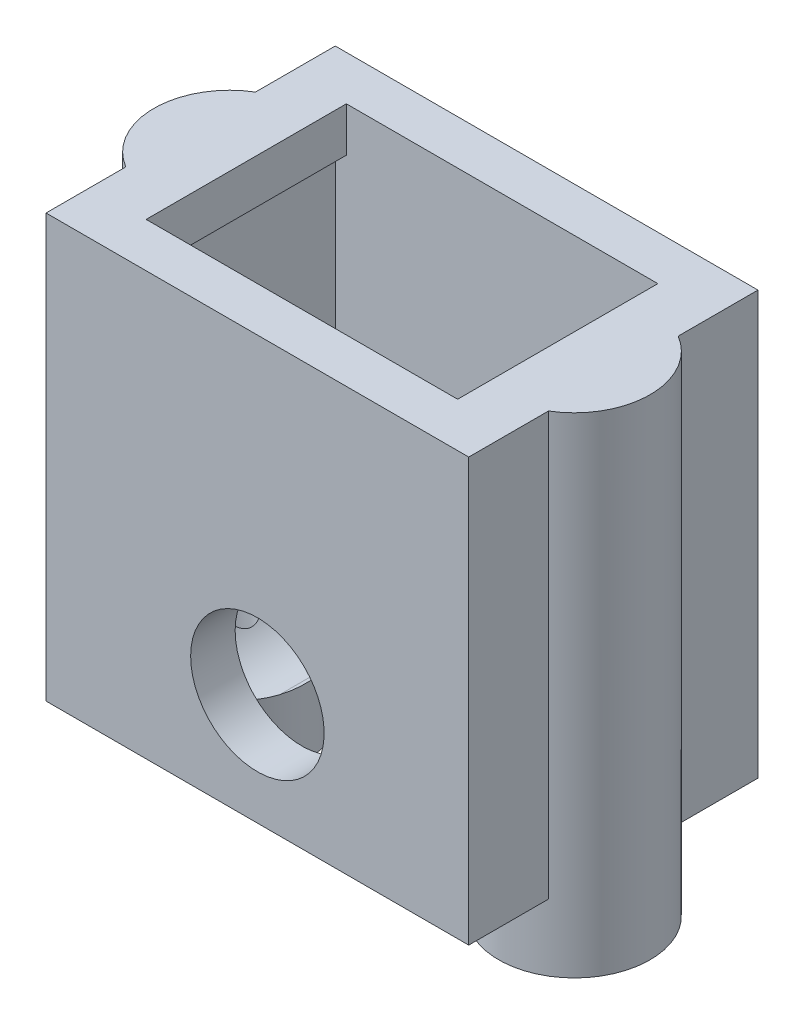
from build123d import *

# Parameters (mm, degrees)
ESBO_O1_W                = 19
ESBO_O1_H                = 13
ESBO_O1_W_2              = 15
ESBO_O1_H_2              = 9
RESSALTO_EXTRUS_O1_DEPTH = 17
ESBO_O2_R                = 3.4
ESBO_O2_R_2              = 1
RESSALTO_EXTRUS_O2_DEPTH = 3
FILETE1_R                = 3
RESSALTO_EXTRUS_O3_START = 19
RESSALTO_EXTRUS_O3_DEPTH = 19
CORTE_EXTRUS_O1_DEPTH    = 26.579728302
ESBO_O5_W                = 0.5
ESBO_O5_H                = 1.584952831
ESBO_O5_W_2              = 2
ESBO_O5_H_2              = 5.830094338
RESSALTO_EXTRUS_O6_DEPTH = 2
CORTE_EXTRUS_O2_START    = -6
ESBO_O7_R                = 1
CORTE_EXTRUS_O2_DEPTH    = 6


with BuildPart() as part:
    # Esboço1 → Ressalto-extrusão1 (new body)
    with BuildSketch(Plane(origin=(0, 0, 0), x_dir=(1, 0, 0), z_dir=(0, 1, 0))):
        Rectangle(ESBO_O1_W, ESBO_O1_H)
        Rectangle(ESBO_O1_W_2, ESBO_O1_H_2, mode=Mode.SUBTRACT)
    extrude(amount=RESSALTO_EXTRUS_O1_DEPTH)

    # Esboço2 → Ressalto-extrusão2 (add)
    # profile 1 of 2: a face of its own
    with BuildSketch(Plane.XZ):
        with Locations(Location((7.75, 0, 0), (0, 0, 94.216730479))):
            Circle(ESBO_O2_R)
        with Locations(Location((7.75, 0, 0), (0, 0, 104.477512186))):
            Circle(ESBO_O2_R_2, mode=Mode.SUBTRACT)
    # profile 2 of 2: a face of its own
    with BuildSketch(Plane.XZ):
        with Locations(Location((-7.75, 0, 0), (0, 0, 85.783269521))):
            Circle(ESBO_O2_R)
        with Locations(Location((-7.75, 0, 0), (0, 0, 75.522487814))):
            Circle(ESBO_O2_R_2, mode=Mode.SUBTRACT)
    extrude(amount=RESSALTO_EXTRUS_O2_DEPTH)

    # Filete1
    # the kernel refuses this fillet: 3 mm, written as the material it adds along each edge
    with BuildSketch(Plane(origin=(-7.5, 0, -6.531754163), x_dir=(0, 1, 0), z_dir=(0, 0, 1))) as filete1_piece_1_section:
        with BuildLine():
            CenterArc((FILETE1_R, -FILETE1_R), FILETE1_R, 90, 90)
            Line((0, -FILETE1_R), (0, 0))
            Line((0, 0), (FILETE1_R, 0))
        make_face()
    filete1_piece_1 = extrude(amount=17.42255053, mode=Mode.PRIVATE)
    filete1_piece_1 = filete1_piece_1 & Plane(origin=(-7.75, 0.863183733, 0), x_dir=(0.07352941176727577, 0, 0.9972930490107501), z_dir=(0, 1, 0)) * Cylinder(3.4, 47, mode=Mode.PRIVATE)
    filete1_piece_1 = filete1_piece_1 - Plane(origin=(-7.75, 0.863183733, 0), x_dir=(0.25000000000118416, 0, 0.9682458365515485), z_dir=(0, 1, 0)) * Cylinder(1, 47, mode=Mode.PRIVATE)
    add(filete1_piece_1)
    with BuildSketch(Plane(origin=(-7.5, 0, -10.890796367), x_dir=(0, 1, 0), z_dir=(0, 0, 1))) as filete1_piece_2_section:
        with BuildLine():
            CenterArc((FILETE1_R, -FILETE1_R), FILETE1_R, 90, 90)
            Line((0, -FILETE1_R), (0, 0))
            Line((0, 0), (FILETE1_R, 0))
        make_face()
    filete1_piece_2 = extrude(amount=17.42255053, mode=Mode.PRIVATE)
    filete1_piece_2 = filete1_piece_2 & Plane(origin=(-7.75, 0.863183733, 0), x_dir=(0.07352941176727577, 0, 0.9972930490107501), z_dir=(0, 1, 0)) * Cylinder(3.4, 47, mode=Mode.PRIVATE)
    filete1_piece_2 = filete1_piece_2 - Plane(origin=(-7.75, 0.863183733, 0), x_dir=(0.25000000000118416, 0, 0.9682458365515485), z_dir=(0, 1, 0)) * Cylinder(1, 47, mode=Mode.PRIVATE)
    add(filete1_piece_2)
    with BuildSketch(Plane(origin=(7.5, 0, 6.531754163), x_dir=(0, 1, 0), z_dir=(0, 0, -1))) as filete1_piece_3_section:
        with BuildLine():
            CenterArc((FILETE1_R, -FILETE1_R), FILETE1_R, 90, 90)
            Line((0, -FILETE1_R), (0, 0))
            Line((0, 0), (FILETE1_R, 0))
        make_face()
    filete1_piece_3 = extrude(amount=17.42255053, mode=Mode.PRIVATE)
    filete1_piece_3 = filete1_piece_3 & Plane(origin=(7.75, 0.863183735, 0), x_dir=(-0.07352941176727565, 0, 0.9972930490107501), z_dir=(0, 1, 0)) * Cylinder(3.4, 47, mode=Mode.PRIVATE)
    filete1_piece_3 = filete1_piece_3 - Plane(origin=(7.75, 0.863183735, 0), x_dir=(-0.25000000000118405, 0, 0.9682458365515485), z_dir=(0, 1, 0)) * Cylinder(1, 47, mode=Mode.PRIVATE)
    add(filete1_piece_3)
    with BuildSketch(Plane(origin=(7.5, 0, 10.890796367), x_dir=(0, 1, 0), z_dir=(0, 0, -1))) as filete1_piece_4_section:
        with BuildLine():
            CenterArc((FILETE1_R, -FILETE1_R), FILETE1_R, 90, 90)
            Line((0, -FILETE1_R), (0, 0))
            Line((0, 0), (FILETE1_R, 0))
        make_face()
    filete1_piece_4 = extrude(amount=17.42255053, mode=Mode.PRIVATE)
    filete1_piece_4 = filete1_piece_4 & Plane(origin=(7.75, 0.863183735, 0), x_dir=(-0.07352941176727565, 0, 0.9972930490107501), z_dir=(0, 1, 0)) * Cylinder(3.4, 47, mode=Mode.PRIVATE)
    filete1_piece_4 = filete1_piece_4 - Plane(origin=(7.75, 0.863183735, 0), x_dir=(-0.25000000000118405, 0, 0.9682458365515485), z_dir=(0, 1, 0)) * Cylinder(1, 47, mode=Mode.PRIVATE)
    add(filete1_piece_4)

    # Esboço3 → Ressalto-extrusão3 (add)
    with BuildSketch(Plane(origin=(0, 0, 0), x_dir=(1, 0, 0), z_dir=(0, 1, 0)).offset(RESSALTO_EXTRUS_O3_START)):
        with BuildLine():
            Line((-9.5, -2.915047169), (-9.5, 2.915047169))
            ThreePointArc((-9.5, 2.915047169), (-11.15, 0), (-9.5, -2.915047169))
        make_face()
        with BuildLine():
            Line((9.5, 2.915047169), (9.5, -2.915047169))
            ThreePointArc((9.5, -2.915047169), (11.15, 0), (9.5, 2.915047169))
        make_face()
    extrude(amount=-RESSALTO_EXTRUS_O3_DEPTH)

    # Esboço6 → Corte-extrusão1 (cut, through all)
    with BuildSketch(Plane(origin=(0, 0, -6.5), x_dir=(-1, 0, 0), z_dir=(0, 0, -1))):
        with BuildLine():
            ThreePointArc((-3, 5), (-2.121320344, 2.878679656), (0, 2))
            Line((0, 2), (0, 5))
            Line((0, 5), (-3, 5))
        make_face()
        with BuildLine():
            Line((0, 5), (0, 2))
            ThreePointArc((0, 2), (2.121320344, 2.878679656), (3, 5))
            ThreePointArc((3, 5), (0, 8), (-3, 5))
            Line((-3, 5), (0, 5))
        make_face()
    extrude(amount=-CORTE_EXTRUS_O1_DEPTH, mode=Mode.SUBTRACT)

    # Esboço5 → Ressalto-extrusão6 (add)
    with BuildSketch(Plane(origin=(0, 17, 0), x_dir=(1, 0, 0), z_dir=(0, 1, 0))):
        Polygon((7.5, -4.5), (7, -4.5), (3, -4.5), (-3, -4.5), (-7, -4.5), (-7.5, -4.5), (-7.5, -2.915047169), (-9.5, -2.915047169), (-9.5, -6.5), (-3, -6.5), (3, -6.5), (9.5, -6.5), (9.5, -2.915047169), (7.5, -2.915047169), align=None)
        with Locations((7.25, -3.707523585)):
            Rectangle(ESBO_O5_W, ESBO_O5_H)
        with Locations((7.25, 3.707523585)):
            Rectangle(ESBO_O5_W, ESBO_O5_H)
        Polygon((3, 4.5), (7, 4.5), (7.5, 4.5), (7.5, 2.915047169), (9.5, 2.915047169), (9.5, 6.5), (3, 6.5), (-3, 6.5), (-9.5, 6.5), (-9.5, 2.915047169), (-7.5, 2.915047169), (-7.5, 4.5), (-7, 4.5), (-3, 4.5), align=None)
        with Locations((-7.25, -3.707523585)):
            Rectangle(ESBO_O5_W, ESBO_O5_H)
        with Locations((-7.25, 3.707523585)):
            Rectangle(ESBO_O5_W, ESBO_O5_H)
        with Locations((8.5, 0)):
            Rectangle(ESBO_O5_W_2, ESBO_O5_H_2)
        with Locations((-8.5, 0)):
            Rectangle(ESBO_O5_W_2, ESBO_O5_H_2)
        with Locations((-7.25, 0)):
            Rectangle(ESBO_O5_W, ESBO_O5_H_2)
        with Locations((7.25, 0)):
            Rectangle(ESBO_O5_W, ESBO_O5_H_2)
    extrude(amount=RESSALTO_EXTRUS_O6_DEPTH)

    # Esboço7 → Corte-extrusão2 (cut)
    with BuildSketch(Plane.XZ.offset(3).offset(CORTE_EXTRUS_O2_START)):
        with Locations(Location((-7.75, 0, 0), (0, 0, 75.522487814))):
            Circle(ESBO_O7_R)
        with Locations(Location((7.75, 0, 0), (0, 0, 104.477512186))):
            Circle(ESBO_O7_R)
    extrude(amount=CORTE_EXTRUS_O2_DEPTH, mode=Mode.SUBTRACT)


solid = part.part
